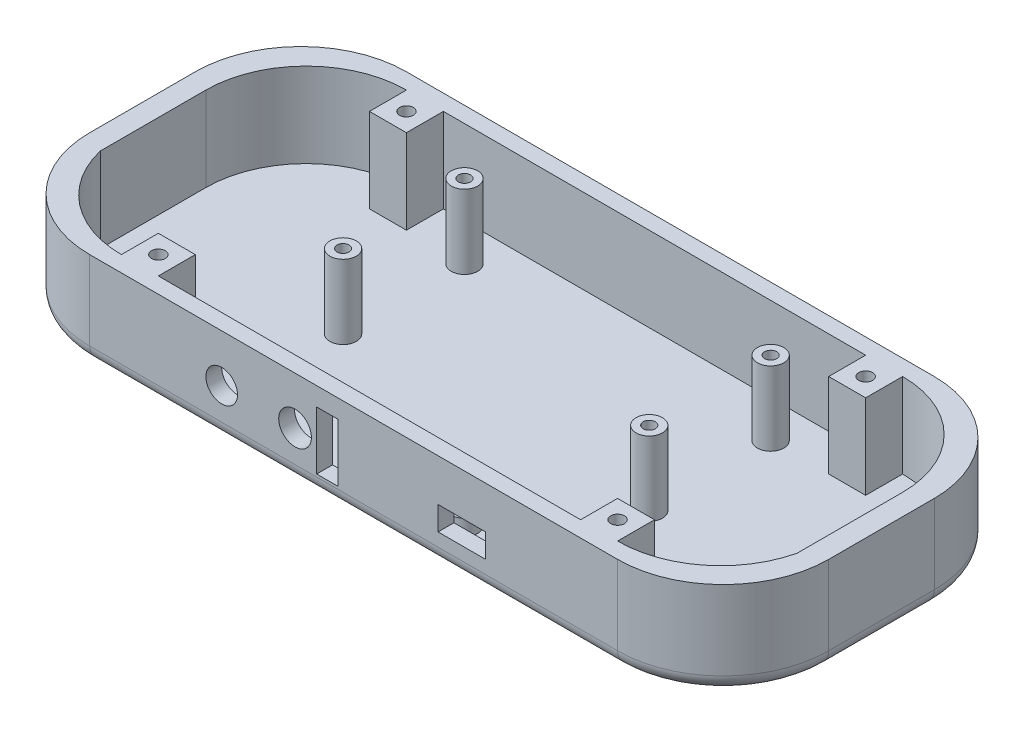
from build123d import *

# Parameters (mm, degrees)
BOSS_EXTRUDE1_DEPTH = 2
BOSS_EXTRUDE2_DEPTH = 16
SKETCH12_W          = 7
SKETCH12_H          = 7
BOSS_EXTRUDE5_DEPTH = 16
FILLET1_R           = 3
SKETCH13_R          = 1.3
CUT_EXTRUDE7_DEPTH  = 79.255990314
SKETCH14_R          = 2.5
SKETCH14_R_2        = 1.15
BOSS_EXTRUDE6_DEPTH = 14
SKETCH15_R          = 2.5
SKETCH15_R_2        = 1.3
BOSS_EXTRUDE7_DEPTH = 3
SKETCH16_W          = 9
SKETCH16_H          = 4.5
CUT_EXTRUDE8_DEPTH  = 93.048900186
SKETCH17_R          = 3.25
CUT_EXTRUDE9_DEPTH  = 13
SKETCH19_R          = 2.5
SKETCH19_R_2        = 1.15
BOSS_EXTRUDE8_DEPTH = 2.5
SKETCH20_R          = 3.1
SKETCH20_R_2        = 3
SKETCH20_W          = 4
SKETCH20_H          = 11
CUT_EXTRUDE10_DEPTH = 5
CUT_EXTRUDE11_START = -3.5
SKETCH21_R          = 1.15
CUT_EXTRUDE11_DEPTH = 3.5
CUT_EXTRUDE12_START = -3.5
SKETCH22_R          = 1.15
CUT_EXTRUDE12_DEPTH = 3.5


with BuildPart() as part:
    # Sketch1 → Boss-Extrude1 (new body)
    with BuildSketch(Plane(origin=(0, 0, 0), x_dir=(1, 0, 0), z_dir=(0, 1, 0))):
        with BuildLine():
            Line((70, 10), (70, -10))
            ThreePointArc((70, -10), (64.142135624, -24.142135624), (50, -30))
            Line((50, -30), (-50, -30))
            ThreePointArc((-50, -30), (-64.142135624, -24.142135624), (-70, -10))
            Line((-70, -10), (-70, 10))
            ThreePointArc((-70, 10), (-64.142135624, 24.142135624), (-50, 30))
            Line((-50, 30), (50, 30))
            ThreePointArc((50, 30), (64.142135624, 24.142135624), (70, 10))
        make_face()
    extrude(amount=BOSS_EXTRUDE1_DEPTH)

    # Sketch2 → Boss-Extrude2 (add)
    with BuildSketch(Plane(origin=(0, 2, 0), x_dir=(1, 0, 0), z_dir=(0, 1, 0))):
        with BuildLine():
            Line((50, 30), (-50, 30))
            ThreePointArc((-50, 30), (-64.142135624, 24.142135624), (-70, 10))
            Line((-70, 10), (-70, -10))
            ThreePointArc((-70, -10), (-64.142135624, -24.142135624), (-50, -30))
            Line((-50, -30), (50, -30))
            ThreePointArc((50, -30), (64.142135624, -24.142135624), (70, -10))
            Line((70, -10), (70, 10))
            ThreePointArc((70, 10), (64.142135624, 24.142135624), (50, 30))
        make_face()
        with BuildLine():
            ThreePointArc((-66, 8), (-60.435028843, 21.435028843), (-47, 27))
            Line((-47, 27), (47, 27))
            ThreePointArc((47, 27), (60.435028843, 21.435028843), (66, 8))
            Line((66, 8), (66, -12))
            ThreePointArc((66, -12), (59.103718437, -22.798043353), (47, -27))
            Line((47, -27), (-47, -27))
            ThreePointArc((-47, -27), (-59.103718437, -22.798043353), (-66, -12))
            Line((-66, -12), (-66, 8))
        make_face(mode=Mode.SUBTRACT)
    extrude(amount=BOSS_EXTRUDE2_DEPTH)

    # Sketch12 → Boss-Extrude5 (add)
    with BuildSketch(Plane(origin=(0, 2, 0), x_dir=(1, 0, 0), z_dir=(0, 1, 0))):
        with Locations((-43.5, 23.5)):
            Rectangle(SKETCH12_W, SKETCH12_H)
        with Locations((-43.5, -23.5)):
            Rectangle(SKETCH12_W, SKETCH12_H)
        with Locations((43.5, -23.5)):
            Rectangle(SKETCH12_W, SKETCH12_H)
        with Locations((43.5, 23.5)):
            Rectangle(SKETCH12_W, SKETCH12_H)
    extrude(amount=BOSS_EXTRUDE5_DEPTH)

    # Fillet1
    fillet1_edges = [part.edges().sort_by_distance(p)[0] for p in [
        (-64.142135624, 0, 24.142135624),
        (-64.142135624, 0, -24.142135624),
        (-70, 0, 0),
        (0, 0, 30),
        (64.142135624, 0, 24.142135624),
        (70, 0, 0),
        (64.142135624, 0, -24.142135624),
        (0, 0, -30),
    ]]
    fillet(fillet1_edges, radius=FILLET1_R)

    # Sketch13 → Cut-Extrude7 (cut, through all)
    with BuildSketch(Plane(origin=(0, 18, 0), x_dir=(1, 0, 0), z_dir=(0, 1, 0))):
        with Locations((-43.5, 23.5)):
            Circle(SKETCH13_R)
        with Locations((-43.5, -23.5)):
            Circle(SKETCH13_R)
        with Locations((43.5, -23.5)):
            Circle(SKETCH13_R)
        with Locations((43.5, 23.5)):
            Circle(SKETCH13_R)
    extrude(amount=-CUT_EXTRUDE7_DEPTH, mode=Mode.SUBTRACT)

    # Sketch14 → Boss-Extrude6 (add)
    # profile 1 of 4: a face of its own
    with BuildSketch(Plane(origin=(0, 2, 0), x_dir=(1, 0, 0), z_dir=(0, 1, 0))):
        with Locations((29, -3)):
            Circle(SKETCH14_R)
        with Locations((29, -3)):
            Circle(SKETCH14_R_2, mode=Mode.SUBTRACT)
    # profile 2 of 4: a face of its own
    with BuildSketch(Plane(origin=(0, 2, 0), x_dir=(1, 0, 0), z_dir=(0, 1, 0))):
        with Locations((29, 20)):
            Circle(SKETCH14_R)
        with Locations((29, 20)):
            Circle(SKETCH14_R_2, mode=Mode.SUBTRACT)
    # profile 3 of 4: a face of its own
    with BuildSketch(Plane(origin=(0, 2, 0), x_dir=(1, 0, 0), z_dir=(0, 1, 0))):
        with Locations((-29, 20)):
            Circle(SKETCH14_R)
        with Locations((-29, 20)):
            Circle(SKETCH14_R_2, mode=Mode.SUBTRACT)
    # profile 4 of 4: a face of its own
    with BuildSketch(Plane(origin=(0, 2, 0), x_dir=(1, 0, 0), z_dir=(0, 1, 0))):
        with Locations((-29, -3)):
            Circle(SKETCH14_R)
        with Locations((-29, -3)):
            Circle(SKETCH14_R_2, mode=Mode.SUBTRACT)
    extrude(amount=BOSS_EXTRUDE6_DEPTH)

    # Sketch15 → Boss-Extrude7 (add)
    # profile 1 of 2: a face of its own
    with BuildSketch(Plane(origin=(0, 2, 0), x_dir=(1, 0, 0), z_dir=(0, 1, 0))):
        with Locations((29, -23)):
            Circle(SKETCH15_R)
        with Locations((29, -23)):
            Circle(SKETCH15_R_2, mode=Mode.SUBTRACT)
    # profile 2 of 2: a face of its own
    with BuildSketch(Plane(origin=(0, 2, 0), x_dir=(1, 0, 0), z_dir=(0, 1, 0))):
        with Locations((14, -23)):
            Circle(SKETCH15_R)
        with Locations((14, -23)):
            Circle(SKETCH15_R_2, mode=Mode.SUBTRACT)
    extrude(amount=BOSS_EXTRUDE7_DEPTH)

    # Sketch16 → Cut-Extrude8 (cut, through all)
    with BuildSketch(Plane(origin=(0, 0, 27), x_dir=(-1, 0, 0), z_dir=(0, 0, -1))):
        with Locations((-20.5, 7.75)):
            Rectangle(SKETCH16_W, SKETCH16_H)
    extrude(amount=-CUT_EXTRUDE8_DEPTH, mode=Mode.SUBTRACT)

    # Sketch17 → Cut-Extrude9 (cut)
    with BuildSketch(Plane.XZ):
        with Locations((-43.5, 23.5)):
            Circle(SKETCH17_R)
        with Locations((43.5, 23.5)):
            Circle(SKETCH17_R)
        with Locations((43.5, -23.5)):
            Circle(SKETCH17_R)
        with Locations((-43.5, -23.5)):
            Circle(SKETCH17_R)
    extrude(amount=-CUT_EXTRUDE9_DEPTH, mode=Mode.SUBTRACT)

    # Sketch19 → Boss-Extrude8 (add)
    # profile 1 of 2: a face of its own
    with BuildSketch(Plane(origin=(0, 0, 27), x_dir=(-1, 0, 0), z_dir=(0, 0, -1))):
        with Locations((-1, 9)):
            Circle(SKETCH19_R)
        with Locations((-1, 9)):
            Circle(SKETCH19_R_2, mode=Mode.SUBTRACT)
    # profile 2 of 2: a face of its own
    with BuildSketch(Plane(origin=(0, 0, 27), x_dir=(-1, 0, 0), z_dir=(0, 0, -1))):
        with Locations((34, 9)):
            Circle(SKETCH19_R)
        with Locations((34, 9)):
            Circle(SKETCH19_R_2, mode=Mode.SUBTRACT)
    extrude(amount=BOSS_EXTRUDE8_DEPTH)

    # Sketch20 → Cut-Extrude10 (cut)
    with BuildSketch(Plane(origin=(0, 0, 27), x_dir=(-1, 0, 0), z_dir=(0, 0, -1))):
        with Locations((11.1, 9)):
            Circle(SKETCH20_R)
        with Locations((25, 9)):
            Circle(SKETCH20_R_2)
        with Locations((5, 9)):
            Rectangle(SKETCH20_W, SKETCH20_H)
    extrude(amount=-CUT_EXTRUDE10_DEPTH, mode=Mode.SUBTRACT)

    # Sketch21 → Cut-Extrude11 (cut)
    with BuildSketch(Plane(origin=(0, 0, 24.5), x_dir=(-1, 0, 0), z_dir=(0, 0, -1)).offset(CUT_EXTRUDE11_START)):
        with Locations((-1, 9)):
            Circle(SKETCH21_R)
    extrude(amount=CUT_EXTRUDE11_DEPTH, mode=Mode.SUBTRACT)

    # Sketch22 → Cut-Extrude12 (cut)
    with BuildSketch(Plane(origin=(0, 0, 24.5), x_dir=(-1, 0, 0), z_dir=(0, 0, -1)).offset(CUT_EXTRUDE12_START)):
        with Locations((34, 9)):
            Circle(SKETCH22_R)
    extrude(amount=CUT_EXTRUDE12_DEPTH, mode=Mode.SUBTRACT)


solid = part.part
